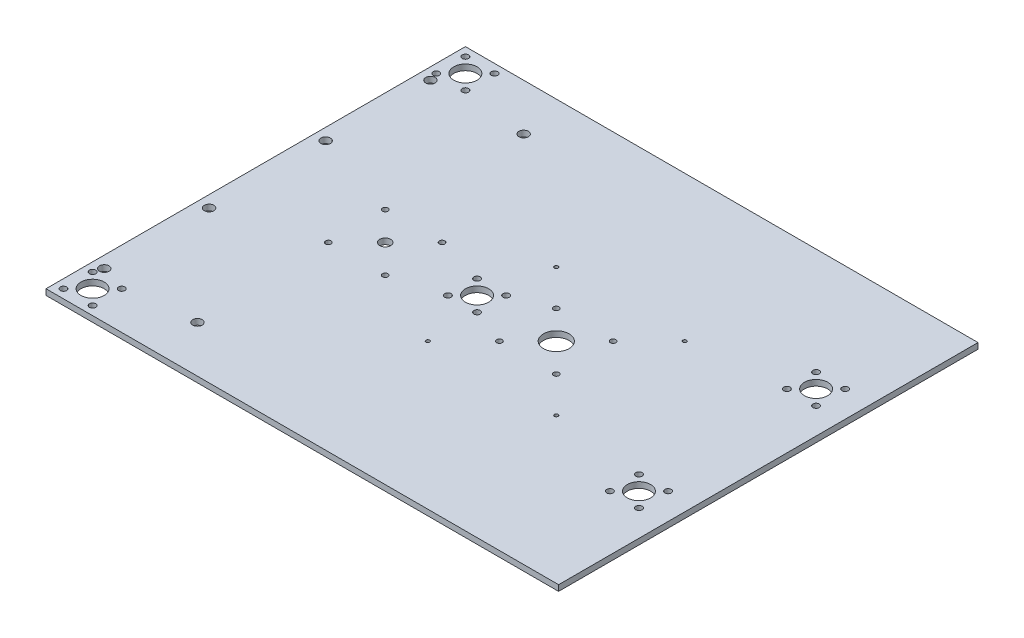
from build123d import *

# Parameters (mm, degrees)
SKETCH1_W               = 279.4
SKETCH1_H               = 228.6
BOSS_EXTRUDE1_DEPTH     = 3.175
SKETCH3_R               = 2.600000007
CUT_EXTRUDE1_DEPTH      = 181.528835993
SKETCH5_R               = 1.5
SKETCH5_R_2             = 2.999999969
CUT_EXTRUDE2_DEPTH      = 181.528835993
SKETCH7_R               = 0.999998
CUT_EXTRUDE3_DEPTH      = 181.528835993
CUT_EXTRUDE5_DEPTH      = 181.528835993
CUT_EXTRUDE5_DEPTH_BACK = 181.528835993
SKETCH9_R               = 1.726999975
SKETCH9_R_2             = 6.35
CUT_EXTRUDE6_DEPTH      = 181.528835993
CUT_EXTRUDE6_DEPTH_BACK = 181.528835993
SKETCH11_R              = 1.5
SKETCH11_R_2            = 6.985


with BuildPart() as part:
    # Sketch1 → Boss-Extrude1 (new body)
    with BuildSketch(Plane(origin=(0, 0, 0), x_dir=(1, 0, 0), z_dir=(0, 1, 0))):
        Rectangle(SKETCH1_W, SKETCH1_H)
    extrude(amount=BOSS_EXTRUDE1_DEPTH)

    # Sketch3 → Cut-Extrude1 (cut, through all)
    with BuildSketch(Plane(origin=(0, 3.175, 0), x_dir=(1, 0, 0), z_dir=(0, 1, 0))):
        with Locations((-133.35, -31.75)):
            Circle(SKETCH3_R)
        with Locations((-82.55, -88.9)):
            Circle(SKETCH3_R)
        with Locations((-133.35, -88.9)):
            Circle(SKETCH3_R)
    cut_extrude1 = extrude(amount=-CUT_EXTRUDE1_DEPTH, mode=Mode.SUBTRACT)

    # Mirror1: Cut-Extrude1 across plane
    add(cut_extrude1.mirror(Plane.XY), mode=Mode.SUBTRACT)

    # Sketch5 → Cut-Extrude2 (cut, through all)
    with BuildSketch(Plane(origin=(0, 3.175, 0), x_dir=(1, 0, 0), z_dir=(0, 1, 0))):
        with Locations((-53.612, 15.5)):
            Circle(SKETCH5_R)
        with Locations((-53.612, -15.5)):
            Circle(SKETCH5_R)
        with Locations((-84.612, 15.5)):
            Circle(SKETCH5_R)
        with Locations((-84.612, -15.5)):
            Circle(SKETCH5_R)
        with Locations((-69.112, 0)):
            Circle(SKETCH5_R_2)
    extrude(amount=-CUT_EXTRUDE2_DEPTH, mode=Mode.SUBTRACT)

    # Sketch7 → Cut-Extrude3 (cut, through all)
    with BuildSketch(Plane(origin=(0, 3.175, 0), x_dir=(1, 0, 0), z_dir=(0, 1, 0))):
        with Locations((59.131787507, -35.001787507)):
            Circle(SKETCH7_R)
        with Locations((-10.871787507, -35.001787507)):
            Circle(SKETCH7_R)
        with Locations((-10.871787507, 35.001787507)):
            Circle(SKETCH7_R)
        with Locations((59.131787507, 35.001787507)):
            Circle(SKETCH7_R)
    extrude(amount=-CUT_EXTRUDE3_DEPTH, mode=Mode.SUBTRACT)

    # Sketch9 → Cut-Extrude5 (cut, two sides: drawn at the far end of the back side and taken through both)
    with BuildSketch(Plane(origin=(0, 3.175, 0), x_dir=(1, 0, 0), z_dir=(0, 1, 0)).offset(-CUT_EXTRUDE5_DEPTH_BACK)):
        with Locations((-119.0625, -109.5375)):
            Circle(SKETCH9_R)
        with Locations((-119.0625, -93.6625)):
            Circle(SKETCH9_R)
        with Locations((-134.9375, -93.6625)):
            Circle(SKETCH9_R)
        with Locations((-134.9375, -109.5375)):
            Circle(SKETCH9_R)
        with Locations((-127, -101.6)):
            Circle(SKETCH9_R_2)
        with Locations((125.4125, -56.1975)):
            Circle(SKETCH9_R)
        with Locations((125.4125, -40.3225)):
            Circle(SKETCH9_R)
        with Locations((117.475, -48.26)):
            Circle(SKETCH9_R_2)
        with Locations((109.5375, -40.3225)):
            Circle(SKETCH9_R)
        with Locations((109.5375, -56.1975)):
            Circle(SKETCH9_R)
        with Locations((-11.1125, 7.9375)):
            Circle(SKETCH9_R)
        with Locations((-11.1125, -7.9375)):
            Circle(SKETCH9_R)
        with Locations((-19.05, 0)):
            Circle(SKETCH9_R_2)
        with Locations((-26.9875, -7.9375)):
            Circle(SKETCH9_R)
        with Locations((-26.9875, 7.9375)):
            Circle(SKETCH9_R)
        with Locations((109.5375, 56.1975)):
            Circle(SKETCH9_R)
        with Locations((109.5375, 40.3225)):
            Circle(SKETCH9_R)
        with Locations((125.4125, 56.1975)):
            Circle(SKETCH9_R)
        with Locations((117.475, 48.26)):
            Circle(SKETCH9_R_2)
        with Locations((125.4125, 40.3225)):
            Circle(SKETCH9_R)
        with Locations((-119.0625, 93.6625)):
            Circle(SKETCH9_R)
        with Locations((-119.0625, 109.5375)):
            Circle(SKETCH9_R)
        with Locations((-134.9375, 109.5375)):
            Circle(SKETCH9_R)
        with Locations((-134.9375, 93.6625)):
            Circle(SKETCH9_R)
        with Locations((-127, 101.6)):
            Circle(SKETCH9_R_2)
    extrude(amount=CUT_EXTRUDE5_DEPTH + CUT_EXTRUDE5_DEPTH_BACK, mode=Mode.SUBTRACT)

    # Sketch11 → Cut-Extrude6 (cut, two sides: drawn at the far end of the back side and taken through both)
    with BuildSketch(Plane(origin=(0, 3.175, 0), x_dir=(1, 0, 0), z_dir=(0, 1, 0)).offset(-CUT_EXTRUDE6_DEPTH_BACK)):
        with Locations((39.63, 15.5)):
            Circle(SKETCH11_R)
        with Locations((39.63, -15.5)):
            Circle(SKETCH11_R)
        with Locations((8.63, -15.5)):
            Circle(SKETCH11_R)
        with Locations((8.63, 15.5)):
            Circle(SKETCH11_R)
        with Locations((24.13, 0)):
            Circle(SKETCH11_R_2)
    extrude(amount=CUT_EXTRUDE6_DEPTH + CUT_EXTRUDE6_DEPTH_BACK, mode=Mode.SUBTRACT)


solid = part.part
